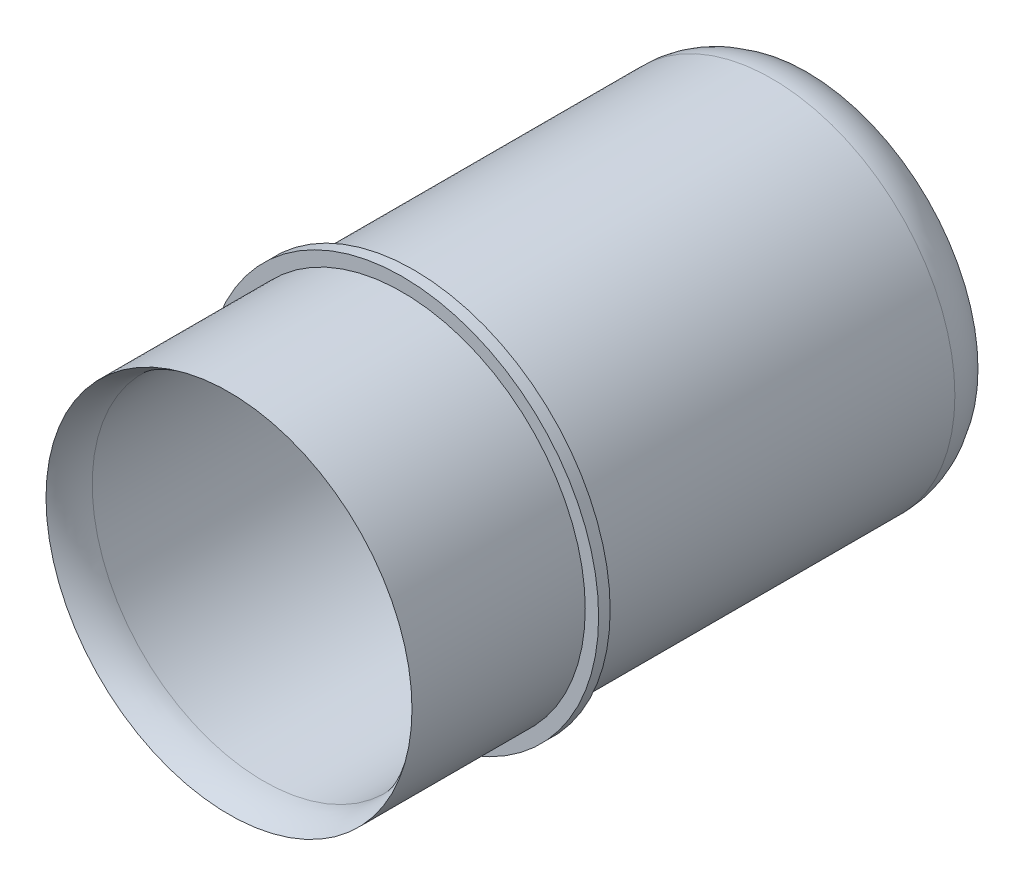
from build123d import *

# Parameters (mm, degrees)
SKETCH1_R           = 31.685
SKETCH1_R_2         = 29.685
BOSS_EXTRUDE1_DEPTH = 50
SKETCH2_R           = 34
SKETCH2_R_2         = 29.685
BOSS_EXTRUDE2_DEPTH = 1
FILLET1_R           = 10


with BuildPart() as part:
    # Sketch1 → Boss-Extrude1 (new, symmetric)
    with BuildSketch(Plane.XY):
        Circle(SKETCH1_R)
        Circle(SKETCH1_R_2, mode=Mode.SUBTRACT)
    extrude(amount=BOSS_EXTRUDE1_DEPTH, both=True)

    # Sketch2 → Boss-Extrude2 (add, symmetric)
    with BuildSketch(Plane.XY.offset(19)):
        Circle(SKETCH2_R)
        Circle(SKETCH2_R_2, mode=Mode.SUBTRACT)
    extrude(amount=BOSS_EXTRUDE2_DEPTH, both=True)

    # Fillet1
    # the kernel refuses this fillet: 10 mm, written as the material it takes off along each edge
    with BuildSketch(Plane(origin=(0, 0, -50), x_dir=(1, 0, 0), z_dir=(0, -1, 0))) as fillet1_piece_1:
        with BuildLine():
            CenterArc((21.685, 6), FILLET1_R, 323.130102354, 36.869897646)
            Line((29.685, 0), (29.845, -0.12))
            ThreePointArc((29.845, -0.12), (30.685, -0.2), (31.685, -0.2))
            Line((31.685, -0.2), (31.885, 0))
            Line((31.885, 0), (31.885, 6))
            Line((31.885, 6), (31.685, 6))
        make_face()
    revolve(axis=Axis((0, 0, -50), (0, 0, 1)), mode=Mode.SUBTRACT)
    with BuildSketch(Plane(origin=(0, 0, 50), x_dir=(1, 0, 0), z_dir=(0, -1, 0))) as fillet1_piece_2:
        with BuildLine():
            CenterArc((39.685, -6), FILLET1_R, 143.130102354, 36.869897646)
            Line((31.685, 0), (31.525, 0.12))
            ThreePointArc((31.525, 0.12), (30.685, 0.2), (29.685, 0.2))
            Line((29.685, 0.2), (29.485, 0))
            Line((29.485, 0), (29.485, -6))
            Line((29.485, -6), (29.685, -6))
        make_face()
    revolve(axis=Axis((0, 0, 50), (0, 0, 1)), mode=Mode.SUBTRACT)


solid = part.part
